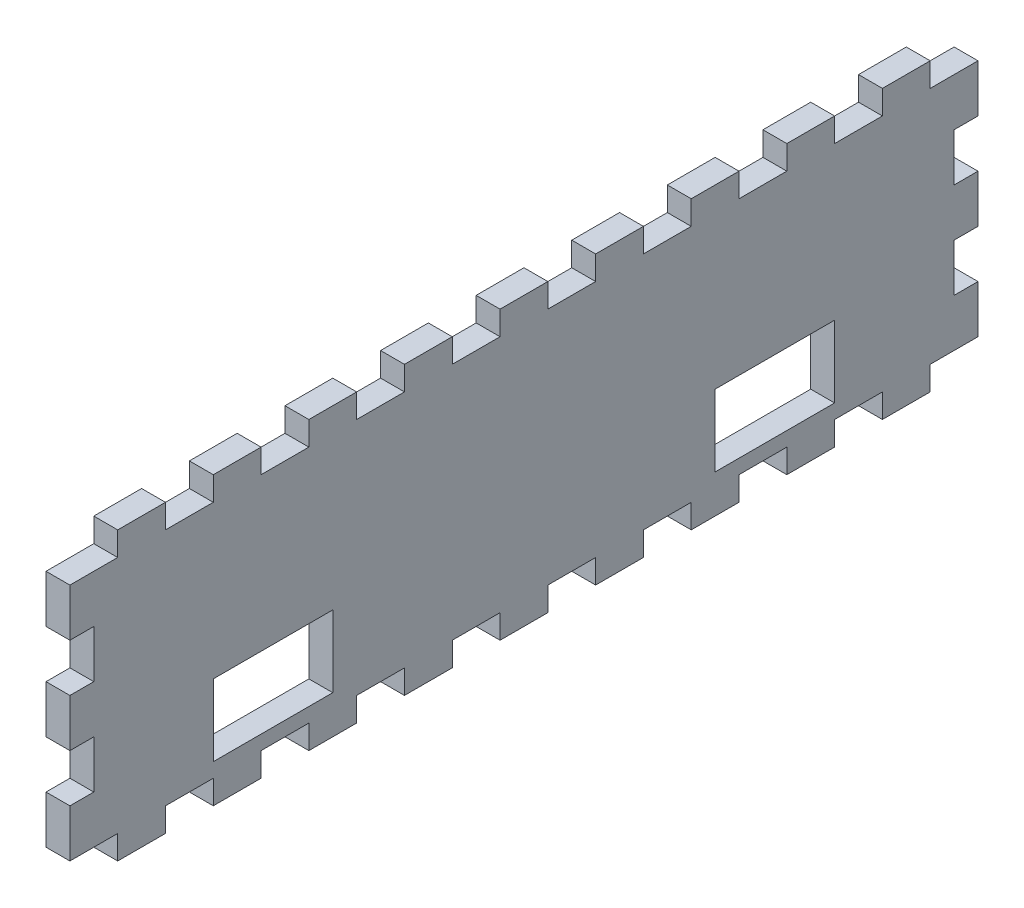
from build123d import *

# Parameters (mm, degrees)
BOSS_EXTRUDE3_DEPTH = 5
SKETCH3_W           = 25
SKETCH3_H           = 15
CUT_EXTRUDE1_DEPTH  = 10


with BuildPart() as part:
    # Sketch2 → Boss-Extrude3 (new body)
    with BuildSketch(Plane(origin=(0, 0, 0), x_dir=(0, 0, -1), z_dir=(1, 0, 0))):
        Polygon((-30.089594047, -3.36324765), (-30.089594047, 1.63675235), (-40.089594047, 1.63675235), (-40.089594047, -3.36324765), (-50.089594047, -3.36324765), (-50.089594047, 1.63675235), (-60.089594047, 1.63675235), (-60.089594047, -3.36324765), (-70.089594047, -3.36324765), (-70.089594047, 1.63675235), (-80.089594047, 1.63675235), (-80.089594047, -3.36324765), (-90.089594047, -3.36324765), (-90.089594047, 1.63675235), (-100.089594047, 1.63675235), (-100.089594047, -3.36324765), (-110.089594047, -3.36324765), (-110.089594047, 1.63675235), (-120.089594047, 1.63675235), (-120.089594047, -3.36324765), (-130.089594047, -3.36324765), (-130.089594047, 1.63675235), (-140.089594047, 1.63675235), (-140.089594047, -3.36324765), (-150.089594047, -3.36324765), (-150.089594047, 1.63675235), (-160.089594047, 1.63675235), (-160.089594047, -3.36324765), (-170.089594047, -3.36324765), (-170.089594047, 1.63675235), (-180.089594047, 1.63675235), (-180.089594047, -3.36324765), (-190.089594047, -3.36324765), (-190.089594047, 1.63675235), (-200.089594047, 1.63675235), (-200.089594047, -3.36324765), (-210.089594047, -3.36324765), (-210.089594047, -13.36324765), (-205.089594047, -13.36324765), (-205.089594047, -23.36324765), (-210.089594047, -23.36324765), (-210.089594047, -33.36324765), (-205.089594047, -33.36324765), (-205.089594047, -43.36324765), (-210.089594047, -43.36324765), (-210.089594047, -53.36324765), (-200.089594047, -53.36324765), (-200.089594047, -58.36324765), (-190.089594047, -58.36324765), (-190.089594047, -53.36324765), (-180.089594047, -53.36324765), (-180.089594047, -58.36324765), (-170.089594047, -58.36324765), (-170.089594047, -53.36324765), (-160.089594047, -53.36324765), (-160.089594047, -58.36324765), (-150.089594047, -58.36324765), (-150.089594047, -53.36324765), (-140.089594047, -53.36324765), (-140.089594047, -58.36324765), (-130.089594047, -58.36324765), (-130.089594047, -53.36324765), (-120.089594047, -53.36324765), (-120.089594047, -58.36324765), (-110.089594047, -58.36324765), (-110.089594047, -53.36324765), (-100.089594047, -53.36324765), (-100.089594047, -58.36324765), (-90.089594047, -58.36324765), (-90.089594047, -53.36324765), (-80.089594047, -53.36324765), (-80.089594047, -58.36324765), (-70.089594047, -58.36324765), (-70.089594047, -53.36324765), (-60.089594047, -53.36324765), (-60.089594047, -58.36324765), (-50.089594047, -58.36324765), (-50.089594047, -53.36324765), (-40.089594047, -53.36324765), (-40.089594047, -58.36324765), (-30.089594047, -58.36324765), (-30.089594047, -53.36324765), (-20.089594047, -53.36324765), (-20.089594047, -43.36324765), (-25.089594047, -43.36324765), (-25.089594047, -33.36324765), (-20.089594047, -33.36324765), (-20.089594047, -23.36324765), (-25.089594047, -23.36324765), (-25.089594047, -13.36324765), (-20.089594047, -13.36324765), (-20.089594047, -3.36324765), align=None)
    extrude(amount=BOSS_EXTRUDE3_DEPTH)

    # Sketch3 → Cut-Extrude1 (cut)
    with BuildSketch(Plane(origin=(5, 0, 0), x_dir=(0, 0, -1), z_dir=(1, 0, 0))):
        with Locations((-167.589594047, -42.86324765)):
            Rectangle(SKETCH3_W, SKETCH3_H)
        with Locations((-62.589594047, -42.86324765)):
            Rectangle(SKETCH3_W, SKETCH3_H)
    extrude(amount=-CUT_EXTRUDE1_DEPTH, mode=Mode.SUBTRACT)


solid = part.part
